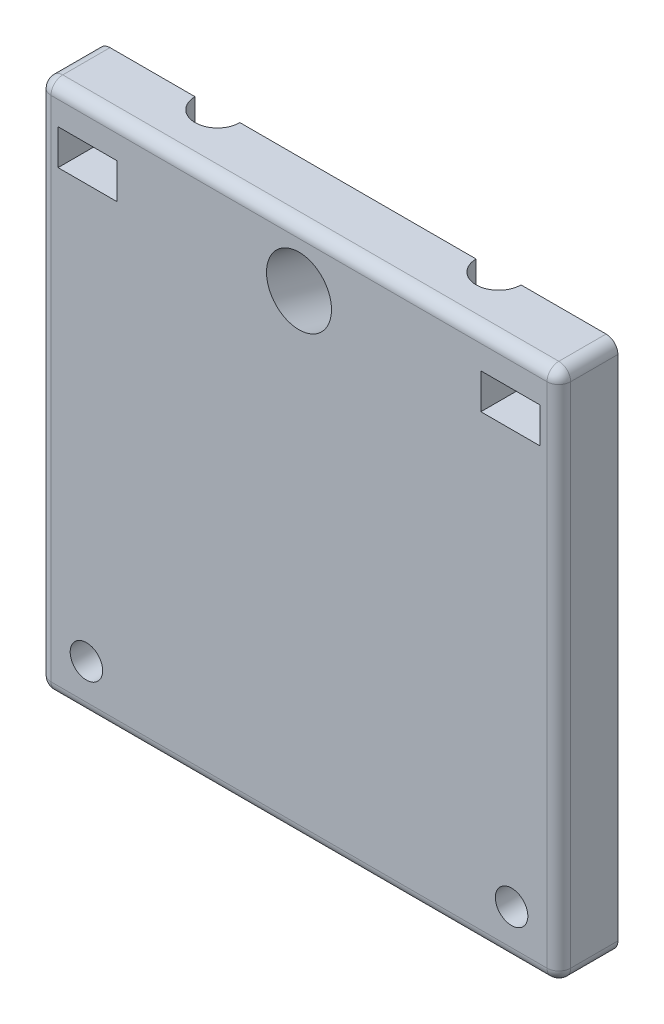
from build123d import *

# Parameters (mm, degrees)
SKETCH1_W                       = 44
SKETCH1_H                       = 45
BASE_DEPTH                      = 5
WIRE_GROOVES_DEPTH              = 51.338851795
SCREW_INSERTION_HOLE_DEPTH      = 33.181634738
SCREW_INSERTION_HOLE_DEPTH_BACK = 33.181634738
SKETCH3_R                       = 2.75
SKETCH5_W                       = 5
SKETCH5_H                       = 3
ZIP_TIE_SLOTS_DEPTH             = 32.862987933
SKETCH6_R                       = 1.375
MOUNT_CLAMPING_HOLES_DEPTH      = 32.862987933
EDGE_FILLETS_R                  = 1


with BuildPart() as part:
    # Sketch1 → Base (new body)
    with BuildSketch(Plane.XY):
        Rectangle(SKETCH1_W, SKETCH1_H)
    extrude(amount=BASE_DEPTH)

    # Sketch2 → Wire Grooves (cut, through all)
    with BuildSketch(Plane(origin=(0, 22.5, 0), x_dir=(1, 0, 0), z_dir=(0, 1, 0))):
        with BuildLine():
            Line((-13.8, 0), (-10, 0))
            ThreePointArc((-10, 0), (-11.9, -1.9), (-13.8, 0))
        make_face()
        with BuildLine():
            Line((13.8, 0), (10, 0))
            ThreePointArc((10, 0), (11.9, -1.9), (13.8, 0))
        make_face()
    extrude(amount=-WIRE_GROOVES_DEPTH, mode=Mode.SUBTRACT)

    # Sketch3 → Screw Insertion Hole (cut, two sides: drawn at the far end of the back side and taken through both)
    with BuildSketch(Plane(origin=(0, 0.596130014, 4.269237963), x_dir=(-1, 0, 0), z_dir=(0, -0.25881904510252135, -0.9659258262890681)).offset(-SCREW_INSERTION_HOLE_DEPTH_BACK)):
        with Locations((0, 16.291616808)):
            Circle(SKETCH3_R)
    extrude(amount=SCREW_INSERTION_HOLE_DEPTH + SCREW_INSERTION_HOLE_DEPTH_BACK, mode=Mode.SUBTRACT)

    # Sketch5 → Zip Tie Slots (cut, through all)
    with BuildSketch(Plane(origin=(0, 0, 0), x_dir=(-1, 0, 0), z_dir=(0, 0, -1))):
        with Locations((17.9, 18)):
            Rectangle(SKETCH5_W, SKETCH5_H)
        with Locations((-17.9, 18)):
            Rectangle(SKETCH5_W, SKETCH5_H)
    extrude(amount=-ZIP_TIE_SLOTS_DEPTH, mode=Mode.SUBTRACT)

    # Sketch6 → Mount Clamping Holes (cut, through all)
    with BuildSketch(Plane(origin=(0, 0, 0), x_dir=(-1, 0, 0), z_dir=(0, 0, -1))):
        with Locations((-18, -18.5)):
            Circle(SKETCH6_R)
        with Locations((18, -18.5)):
            Circle(SKETCH6_R)
    extrude(amount=-MOUNT_CLAMPING_HOLES_DEPTH, mode=Mode.SUBTRACT)

    # Edge Fillets
    edge_fillets_edges = [part.edges().sort_by_distance(p)[0] for p in [
        (-22, 0, 5),
        (22, 0, 5),
        (0, -22.5, 5),
        (0, 22.5, 5),
        (22, 22.5, 2.5),
        (22, -22.5, 2.5),
        (-22, -22.5, 2.5),
        (-22, 22.5, 2.5),
    ]]
    fillet(edge_fillets_edges, radius=EDGE_FILLETS_R)


solid = part.part
